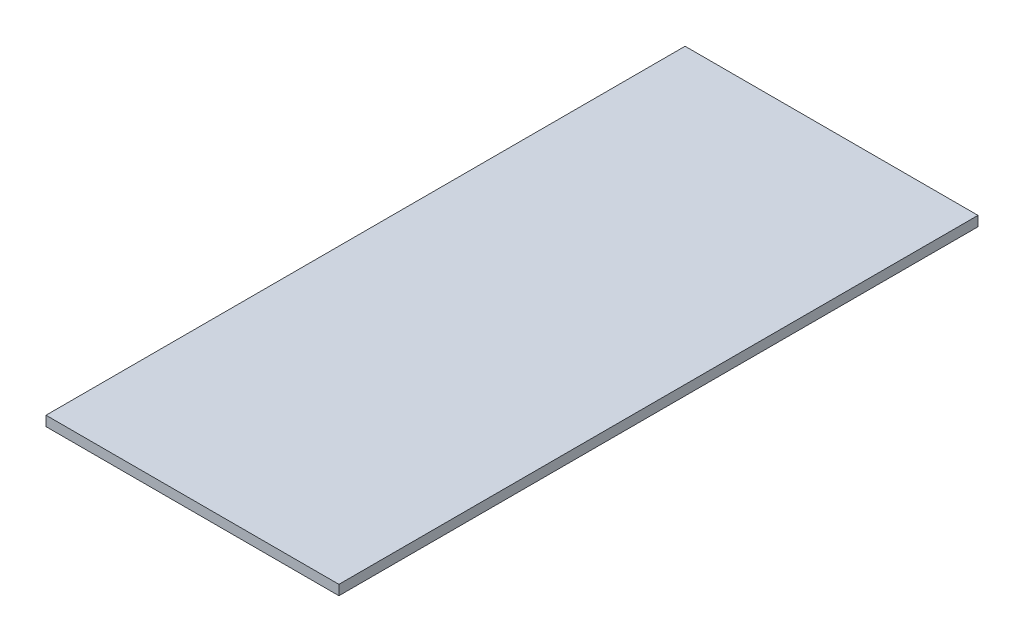
from build123d import *

# Parameters (mm, degrees)
SKETCH1_W           = 69.85
SKETCH1_H           = 152.4
BOSS_EXTRUDE1_DEPTH = 2.3622


with BuildPart() as part:
    # Sketch1 → Boss-Extrude1 (new body)
    with BuildSketch(Plane(origin=(0, 0, 0), x_dir=(1, 0, 0), z_dir=(0, 1, 0))):
        with Locations((-34.925, 76.2)):
            Rectangle(SKETCH1_W, SKETCH1_H)
    extrude(amount=BOSS_EXTRUDE1_DEPTH)


solid = part.part
